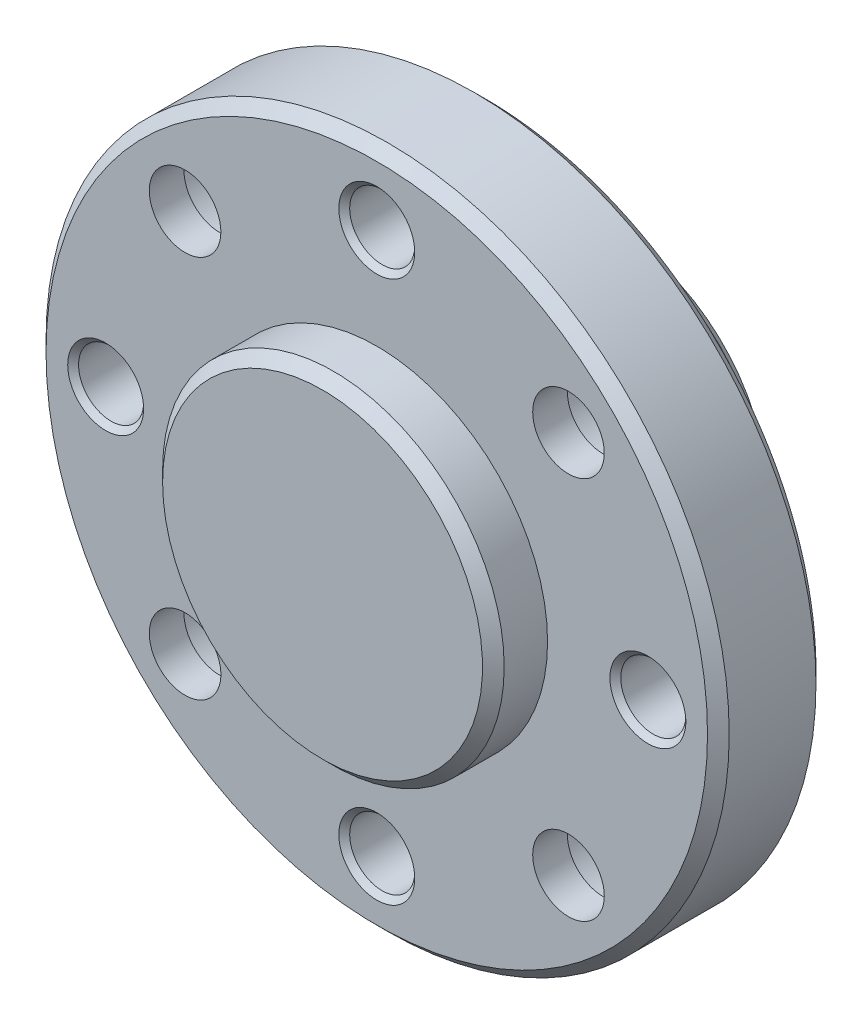
from build123d import *

# Parameters (mm, degrees)
SKETCH_2_R               = 3.3
SKETCH_2_R_2             = 3
CUT_EXTRUDE_1_DEPTH      = 10
SKETCH_2_3_R             = 5.5
SKETCH_2_3_R_2           = 3.3
CUT_EXTRUDE_2_DEPTH      = 6.8
CHAMFER_1_SIZE           = 1
CHAMFER_2_SIZE           = 1
CHAMFER_3_SIZE           = 1
SKETCH_5_W               = 1.65
SKETCH_5_H               = 31.5
PATTERN_CIRCULAR_1_COUNT = 4
CHAMFER_4_SIZE           = 0.5
CHAMFER_5_SIZE           = 1


with BuildPart() as part:
    # 草图1 → 旋转1 (revolve)
    with BuildSketch(Plane(origin=(0, 0, 0), x_dir=(0, 0, -1), z_dir=(1, 0, 0)), mode=Mode.PRIVATE) as revolve_1_sk:
        Polygon((0, 0), (0, 15.75), (5, 15.75), (5, 31.5), (15, 31.5), (15, 15), (27, 15), (27, 10), (3, 10), (3, 0), align=None)
    revolve(revolve_1_sk.sketch.rotate(Axis((0, 0, 27.099264706), (0, 0, -1)), 90), axis=Axis((0, 0, 27.099264706), (0, 0, -1)))

    # 草图2 → 切除-拉伸1 (cut)
    with BuildSketch(Plane(origin=(0, 0, -15), x_dir=(-1, 0, 0), z_dir=(0, 0, -1))):
        with Locations((-17.67766953, 17.67766953)):
            Circle(SKETCH_2_R)
        with Locations((0, 25)):
            Circle(SKETCH_2_R_2)
        with Locations(Location((17.67766953, 17.67766953, 0), (0, 0, 180))):
            Circle(SKETCH_2_R)
        with Locations((17.67766953, -17.67766953)):
            Circle(SKETCH_2_R)
        with Locations(Location((-17.67766953, -17.67766953, 0), (0, 0, 180))):
            Circle(SKETCH_2_R)
        with Locations(Location((0, -25, 0), (0, 0, 180))):
            Circle(SKETCH_2_R_2)
        with Locations(Location((-25, 0, 0), (0, 0, 180))):
            Circle(SKETCH_2_R_2)
        with Locations((25, 0)):
            Circle(SKETCH_2_R_2)
    extrude(amount=-CUT_EXTRUDE_1_DEPTH, mode=Mode.SUBTRACT)

    # 草图2<3> → 切除-拉伸2 (cut)
    # profile 1 of 4: a face of its own
    with BuildSketch(Plane(origin=(0, 0, -15), x_dir=(-1, 0, 0), z_dir=(0, 0, -1))):
        with Locations((-17.67766953, 17.67766953)):
            Circle(SKETCH_2_3_R)
        with Locations((-17.67766953, 17.67766953)):
            Circle(SKETCH_2_3_R_2, mode=Mode.SUBTRACT)
    # profile 2 of 4: a face of its own
    with BuildSketch(Plane(origin=(0, 0, -15), x_dir=(-1, 0, 0), z_dir=(0, 0, -1))):
        with Locations((17.67766953, 17.67766953)):
            Circle(SKETCH_2_3_R)
        with Locations((17.67766953, 17.67766953)):
            Circle(SKETCH_2_3_R_2, mode=Mode.SUBTRACT)
    # profile 3 of 4: a face of its own
    with BuildSketch(Plane(origin=(0, 0, -15), x_dir=(-1, 0, 0), z_dir=(0, 0, -1))):
        with Locations((17.67766953, -17.67766953)):
            Circle(SKETCH_2_3_R)
        with Locations((17.67766953, -17.67766953)):
            Circle(SKETCH_2_3_R_2, mode=Mode.SUBTRACT)
    # profile 4 of 4: a face of its own
    with BuildSketch(Plane(origin=(0, 0, -15), x_dir=(-1, 0, 0), z_dir=(0, 0, -1))):
        with Locations((-17.67766953, -17.67766953)):
            Circle(SKETCH_2_3_R)
        with Locations((-17.67766953, -17.67766953)):
            Circle(SKETCH_2_3_R_2, mode=Mode.SUBTRACT)
    extrude(amount=-CUT_EXTRUDE_2_DEPTH, mode=Mode.SUBTRACT)

    # 倒角1
    chamfer_1_edges = [part.edges().sort_by_distance(p)[0] for p in [
        (-15.75, 0, 0),
    ]]
    chamfer(chamfer_1_edges, length=CHAMFER_1_SIZE)

    # 倒角2
    chamfer_2_edges = [part.edges().sort_by_distance(p)[0] for p in [
        (-10, 0, -27),
    ]]
    chamfer(chamfer_2_edges, length=CHAMFER_2_SIZE)

    # 倒角3
    chamfer_3_edges = [part.edges().sort_by_distance(p)[0] for p in [
        (-31.5, 0, -15),
        (-31.5, 0, -5),
    ]]
    chamfer(chamfer_3_edges, length=CHAMFER_3_SIZE - 0.0001)  # a hair under: the kernel refuses the full size

    # 草图5 → M4 螺纹孔1 (revolve, cut)
    with BuildSketch(Plane(origin=(0, 0, -21), x_dir=(0, 0, -1), z_dir=(1, 0, 0))):
        with Locations((0.825, 15.75)):
            Rectangle(SKETCH_5_W, SKETCH_5_H)
    hole_wizard_m4_1 = revolve(axis=Axis((0, -6.35, -21), (0, 1, 0)), mode=Mode.SUBTRACT)

    # 阵列(圆周)1: M4 螺纹孔1 ×4 about axis
    pattern_circular_1_axis = Axis((0, 0, -27), (0, 0, 1))
    for i in range(1, PATTERN_CIRCULAR_1_COUNT):
        add(hole_wizard_m4_1.rotate(pattern_circular_1_axis, i * 360 / PATTERN_CIRCULAR_1_COUNT), mode=Mode.SUBTRACT)

    # 倒角4
    chamfer_4_edges = [part.edges().sort_by_distance(p)[0] for p in [
        (22, 0, -15),
        (22, 0, -5),
        (3, 25, -5),
        (3, 25, -15),
        (-22, 0, -5),
        (-22, 0, -15),
        (-3, -25, -15),
        (-3, -25, -5),
    ]]
    chamfer(chamfer_4_edges, length=CHAMFER_4_SIZE)

    # 倒角5
    chamfer_5_edges = [part.edges().sort_by_distance(p)[0] for p in [
        (-15, 0, -27),
    ]]
    chamfer(chamfer_5_edges, length=CHAMFER_5_SIZE)


solid = part.part
